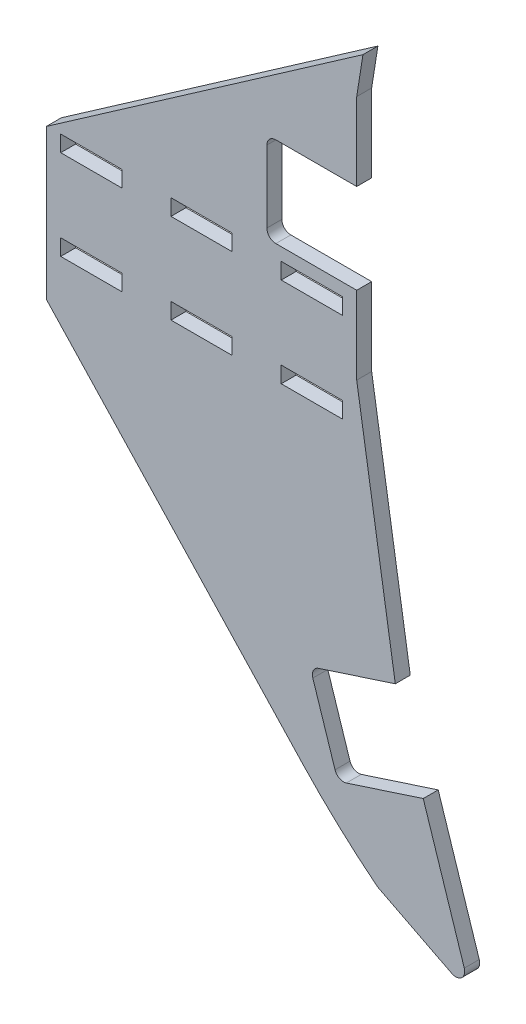
from build123d import *

# Parameters (mm, degrees)
SM_BASE_FLANGE_1_DEPTH = 5
OTHER_START            = -100.2
OTHER_1_OUTLINE_W      = 5.4
OTHER_1_OUTLINE_H      = 5
OTHER_1_DEPTH          = 20.4
OTHER_START_2          = -63.368595269
OTHER_1_2_OUTLINE_W    = 5.4
OTHER_1_2_OUTLINE_H    = 5
OTHER_1_2_DEPTH        = 20.4
OTHER_START_3          = -26.537190538
OTHER_1_3_OUTLINE_W    = 5.4
OTHER_1_3_OUTLINE_H    = 5
OTHER_1_3_DEPTH        = 20.4


# Read off the part's stored shape, not the designer's step: Выступы и прорези-Прорезь1
# Sheet-metal steps are written as plain solids
with BuildPart() as part:
    # Sketch 1 → Базовая кромка1 (new body)
    with BuildSketch(Plane.XY):
        with BuildLine():
            Line((-105, 0), (-105, 30))
            Line((-105, 30), (0.750859603, 103.635517522))
            Line((0.750859603, 103.635517522), (-1.337190538, 90.452087776))
            Line((-1.337190538, 90.452087776), (-1.337190538, 64.447388282))
            Line((-1.337190538, 64.447388282), (-28.337190538, 64.447388282))
            ThreePointArc((-28.337190538, 64.447388282), (-30.458510882, 63.568708625), (-31.337190538, 61.447388282))
            Line((-31.337190538, 61.447388282), (-31.337190538, 37.447388282))
            ThreePointArc((-31.337190538, 37.447388282), (-30.458510882, 35.326067938), (-28.337190538, 34.447388282))
            Line((-28.337190538, 34.447388282), (-1.337190538, 34.447388282))
            Line((-1.337190538, 34.447388282), (-1.337190538, 8.442688787))
            Line((-1.337190538, 8.442688787), (11.55423155, -72.950546947))
            Line((11.55423155, -72.950546947), (-14.065019195, -81.274746116))
            ThreePointArc((-14.065019195, -81.274746116), (-15.810987784, -82.765944166), (-15.991137761, -85.054966648))
            Line((-15.991137761, -85.054966648), (-8.574729896, -107.88032304))
            ThreePointArc((-8.574729896, -107.88032304), (-7.083531846, -109.626291629), (-4.794509364, -109.806441605))
            Line((-4.794509364, -109.806441605), (20.884016576, -101.462982757))
            Line((20.884016576, -101.462982757), (34.59610485, -143.664451098))
            ThreePointArc((34.59610485, -143.664451098), (33.691279446, -146.872719978), (30.380963802, -147.264521653))
            Line((30.380963802, -147.264521653), (5.64897556, -134.662944227))
            ThreePointArc((5.64897556, -134.662944227), (-7.242640853, -123.621288585), (-19.285450277, -111.659571558))
            Line((-19.285450277, -111.659571558), (-105, -20))
            Line((-105, -20), (-105, 0))
        make_face()
    extrude(amount=SM_BASE_FLANGE_1_DEPTH)

    # Other 1 outline → Other 1 (cut)
    with BuildSketch(Plane.YZ.offset(OTHER_START)):
        with Locations((-2.5, 2.5)):
            Rectangle(OTHER_1_OUTLINE_W, OTHER_1_OUTLINE_H)
    other_1 = extrude(amount=OTHER_1_DEPTH, mode=Mode.SUBTRACT)

    # Other 1 2 outline → Other 1 2 (cut)
    with BuildSketch(Plane.YZ.offset(OTHER_START_2)):
        with Locations((-2.5, 2.5)):
            Rectangle(OTHER_1_2_OUTLINE_W, OTHER_1_2_OUTLINE_H)
    other_1_2 = extrude(amount=OTHER_1_2_DEPTH, mode=Mode.SUBTRACT)

    # Other 1 3 outline → Other 1 3 (cut)
    with BuildSketch(Plane.YZ.offset(OTHER_START_3)):
        with Locations((-2.5, 2.5)):
            Rectangle(OTHER_1_3_OUTLINE_W, OTHER_1_3_OUTLINE_H)
    other_1_3 = extrude(amount=OTHER_1_3_DEPTH, mode=Mode.SUBTRACT)

    # Зеркальное отражение1: Other 1, Other 1 2, Other 1 3 across plane
    add(other_1.mirror(Plane.ZX.offset(12.5)), mode=Mode.SUBTRACT)
    add(other_1_2.mirror(Plane.ZX.offset(12.5)), mode=Mode.SUBTRACT)
    add(other_1_3.mirror(Plane.ZX.offset(12.5)), mode=Mode.SUBTRACT)


solid = part.part
